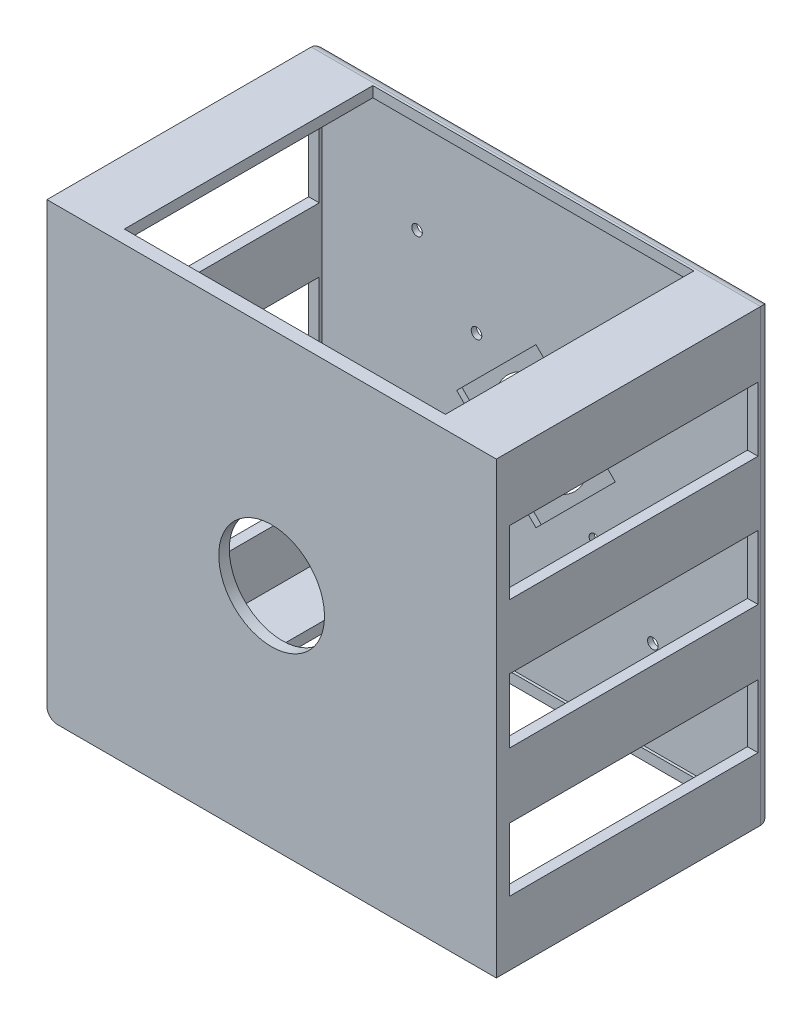
from build123d import *

# Parameters (mm, degrees)
SKETCH_1_W               = 85
SKETCH_1_H               = 85
EXTRUDE_1_DEPTH          = 2
SKETCH_2_R               = 9
CUT_EXTRUDE_1_DEPTH      = 2
SKETCH_4_R               = 5
CUT_EXTRUDE_4_DEPTH      = 1
SKETCH_5_R               = 1
CUT_EXTRUDE_5_DEPTH      = 94.644624303
SKETCH_1_3_W             = 85
SKETCH_1_3_H             = 85
SKETCH_1_3_W_2           = 81
SKETCH_1_3_H_2           = 81
EXTRUDE_2_DEPTH          = 50
SKETCH_7_W               = 85
SKETCH_7_H               = 85
EXTRUDE_3_DEPTH          = 2
CUT_EXTRUDE_6_DEPTH      = 118.678046964
CUT_EXTRUDE_6_DEPTH_BACK = 118.678046964
CUT_EXTRUDE_7_DEPTH      = 122.55325139
CUT_EXTRUDE_7_DEPTH_BACK = 122.55325139
SKETCH_10_W              = 60.714285714
SKETCH_10_H              = 47.002651285
CHAMFER_4_SIZE           = 1
FILLET_1_R               = 2
FILLET_2_R               = 2
SKETCH_11_R              = 10
CUT_EXTRUDE_8_DEPTH      = 10
CUT_EXTRUDE_9_DEPTH      = 1


with BuildPart() as part:
    # 草图1 → 凸台-拉伸1 (new body)
    with BuildSketch(Plane.XY):
        with Locations((27.114602804, -20.102897196)):
            Rectangle(SKETCH_1_W, SKETCH_1_H)
    extrude(amount=EXTRUDE_1_DEPTH)

    # 草图2 → 切除-拉伸1 (cut)
    with BuildSketch(Plane(origin=(0, 0, 0), x_dir=(-1, 0, 0), z_dir=(0, 0, -1))):
        with Locations((-27.114602804, -20.102897196)):
            Circle(SKETCH_2_R)
    extrude(amount=-CUT_EXTRUDE_1_DEPTH, mode=Mode.SUBTRACT)

    # 草图4 → 切除-拉伸4 (cut)
    with BuildSketch(Plane(origin=(0, 0, 0), x_dir=(-1, 0, 0), z_dir=(0, 0, -1))):
        with Locations((-49.215493554, -42.995049302)):
            Circle(SKETCH_4_R)
        with Locations((-38.165048179, -31.548973249)):
            Circle(SKETCH_4_R)
        with Locations((-49.614602804, 2.397102804)):
            Circle(SKETCH_4_R)
        with Locations((-38.364602804, -8.852897196)):
            Circle(SKETCH_4_R)
        with Locations((-4.614602804, -42.602897196)):
            Circle(SKETCH_4_R)
        with Locations((-15.864602804, -31.352897196)):
            Circle(SKETCH_4_R)
        with Locations((-4.614602804, 2.397102804)):
            Circle(SKETCH_4_R)
        with Locations((-15.864602804, -8.852897196)):
            Circle(SKETCH_4_R)
    extrude(amount=-CUT_EXTRUDE_4_DEPTH, mode=Mode.SUBTRACT)

    # 草图5 → 切除-拉伸5 (cut, through all)
    with BuildSketch(Plane(origin=(0, 0, 0), x_dir=(-1, 0, 0), z_dir=(0, 0, -1))):
        with Locations((-4.614602804, -42.602897196)):
            Circle(SKETCH_5_R)
        with Locations((-15.864602804, -31.352897196)):
            Circle(SKETCH_5_R)
        with Locations((-15.864602804, -8.852897196)):
            Circle(SKETCH_5_R)
        with Locations((-4.614602804, 2.397102804)):
            Circle(SKETCH_5_R)
        with Locations((-38.364602804, -8.852897196)):
            Circle(SKETCH_5_R)
        with Locations((-49.614602804, 2.397102804)):
            Circle(SKETCH_5_R)
        with Locations((-49.215493554, -42.995049302)):
            Circle(SKETCH_5_R)
        with Locations((-38.165048179, -31.548973249)):
            Circle(SKETCH_5_R)
    extrude(amount=-CUT_EXTRUDE_5_DEPTH, mode=Mode.SUBTRACT)

    # 草图1<3> → 凸台-拉伸2 (add)
    with BuildSketch(Plane.XY):
        with Locations((27.114602804, -20.102897196)):
            Rectangle(SKETCH_1_3_W, SKETCH_1_3_H)
        with Locations((27.114602804, -20.102897196)):
            Rectangle(SKETCH_1_3_W_2, SKETCH_1_3_H_2, mode=Mode.SUBTRACT)
    extrude(amount=EXTRUDE_2_DEPTH)

    # 草图7 → 凸台-拉伸3 (add)
    with BuildSketch(Plane.XY.offset(50)):
        with Locations((27.114602804, -20.102897196)):
            Rectangle(SKETCH_7_W, SKETCH_7_H)
    extrude(amount=EXTRUDE_3_DEPTH)

    # 草图9 → 切除-拉伸6 (cut, two sides: drawn at the far end of the back side and taken through both)
    with BuildSketch(Plane(origin=(69.614602804, 0, 0), x_dir=(0, 0, -1), z_dir=(1, 0, 0)).offset(-CUT_EXTRUDE_6_DEPTH_BACK)):
        Polygon((-2.49772747, -50.460040053), (-49.5, -50.460040053), (-49.5, -38.482138921), (-2.49810108, -38.482138921), align=None)
        Polygon((-2.49848498, -26.174325768), (-49.5, -26.174325768), (-49.5, -14.031468625), (-2.498863735, -14.031468625), align=None)
        Polygon((-2.49924249, -1.888611482), (-49.5, -1.888611482), (-49.5, 10.254245661), (-2.499621245, 10.254245661), align=None)
    extrude(amount=CUT_EXTRUDE_6_DEPTH + CUT_EXTRUDE_6_DEPTH_BACK, mode=Mode.SUBTRACT)

    # 草图10 → 切除-拉伸7 (cut, two sides: drawn at the far end of the back side and taken through both)
    with BuildSketch(Plane.XZ.offset(62.602897196).offset(-CUT_EXTRUDE_7_DEPTH_BACK)):
        with Locations((27.114602804, 25.998674358)):
            Rectangle(SKETCH_10_W, SKETCH_10_H)
    extrude(amount=CUT_EXTRUDE_7_DEPTH + CUT_EXTRUDE_7_DEPTH_BACK, mode=Mode.SUBTRACT)

    # 倒角4
    chamfer_4_edges = [part.edges().sort_by_distance(p)[0] for p in [
        (36.114602804, -20.102897196, 0),
    ]]
    chamfer(chamfer_4_edges, length=CHAMFER_4_SIZE)

    # 圆角1
    fillet_1_edges = [part.edges().sort_by_distance(p)[0] for p in [
        (27.114602804, 22.397102804, 0),
        (69.614602804, -20.102897196, 0),
        (27.114602804, -62.602897196, 0),
        (-15.385397196, -20.102897196, 0),
    ]]
    fillet(fillet_1_edges, radius=FILLET_1_R)

    # 圆角2
    # the kernel refuses this fillet: 2 mm, written as the material it takes off along each edge
    with BuildSketch(Plane(origin=(-13.385397196, -60.602897196, 2), x_dir=(0, -1, 0), z_dir=(-1, 0, 0))) as fillet_2_piece_1_section:
        Polygon((0, 0), (FILLET_2_R, 0), (FILLET_2_R, -FILLET_2_R), (0, -FILLET_2_R), align=None)
    fillet_2_piece_1 = extrude(amount=FILLET_2_R, mode=Mode.PRIVATE)
    fillet_2_piece_1 = fillet_2_piece_1 - Plane(origin=(-13.385397196, -60.602897196, 2), x_dir=(0, 0.7071067811865475, 0.7071067811865475), z_dir=(-1, 0, 0)) * Sphere(FILLET_2_R, mode=Mode.PRIVATE)
    add(fillet_2_piece_1, mode=Mode.SUBTRACT)
    with BuildSketch(Plane(origin=(-15.385397196, -62.602897196, 2), x_dir=(0, 1, 0), z_dir=(0, 0, 1))) as fillet_2_piece_2:
        with BuildLine():
            CenterArc((FILLET_2_R, -FILLET_2_R), FILLET_2_R, 90, 90)
            Line((0, -FILLET_2_R), (0, 0))
            Line((0, 0), (FILLET_2_R, 0))
        make_face()
    extrude(amount=55, mode=Mode.SUBTRACT)

    # 草图11 → 切除-拉伸8 (cut)
    with BuildSketch(Plane.XY.offset(52)):
        with Locations((27.114602804, -19.602897196)):
            Circle(SKETCH_11_R)
    extrude(amount=-CUT_EXTRUDE_8_DEPTH, mode=Mode.SUBTRACT)

    # 草图12 → 切除-拉伸9 (cut)
    with BuildSketch(Plane.XY.offset(2)):
        Polygon((12.114602804, -20.102897196), (27.114602804, -35.102897196), (42.114602804, -20.102897196), (27.114602804, -5.102897196), align=None)
    extrude(amount=-CUT_EXTRUDE_9_DEPTH, mode=Mode.SUBTRACT)


solid = part.part
